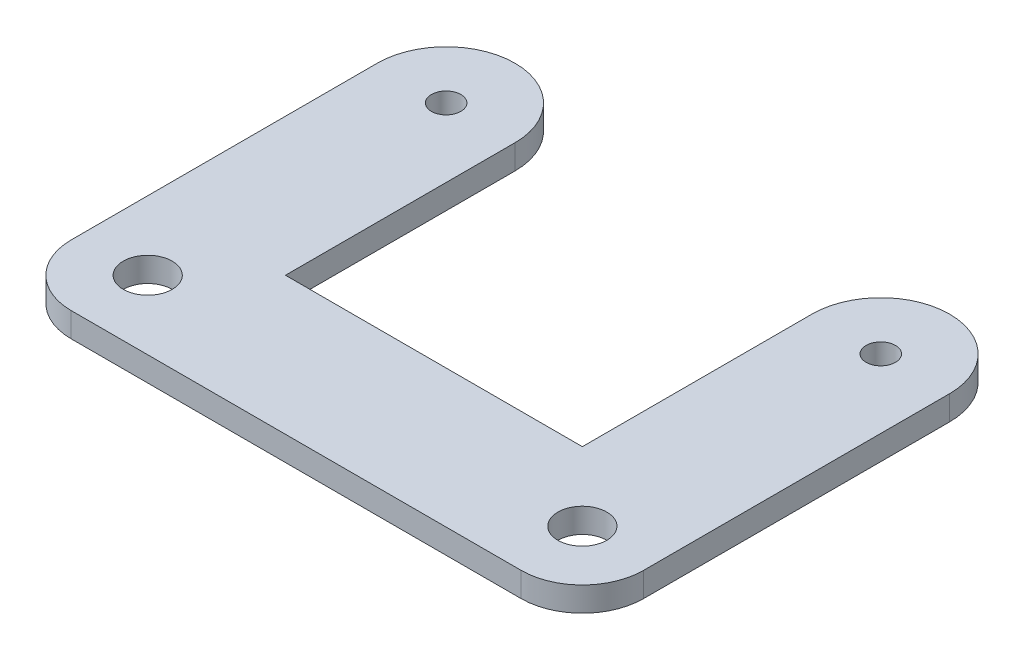
from build123d import *

# Parameters (mm, degrees)
SKETCH1_R           = 2.4
SKETCH1_R_2         = 4
BOSS_EXTRUDE1_DEPTH = 4
FILLET1_R           = 10


with BuildPart() as part:
    # Sketch1 → Boss-Extrude1 (new body)
    with BuildSketch(Plane(origin=(0, 0, 0), x_dir=(1, 0, 0), z_dir=(0, 1, 0))):
        with BuildLine():
            ThreePointArc((-24.25, 0), (-35.5, 11.25), (-46.75, 0))
            Line((-46.75, 0), (-46.75, -60))
            Line((-46.75, -60), (46.75, -60))
            Line((46.75, -60), (46.75, 0))
            ThreePointArc((46.75, 0), (35.5, 11.25), (24.25, 0))
            Line((24.25, 0), (24.25, -37.5))
            Line((24.25, -37.5), (-24.25, -37.5))
            Line((-24.25, -37.5), (-24.25, 0))
        make_face()
        with Locations((-35.5, 0)):
            Circle(SKETCH1_R, mode=Mode.SUBTRACT)
        with Locations((35.5, -48.75)):
            Circle(SKETCH1_R_2, mode=Mode.SUBTRACT)
        with Locations((-35.5, -48.75)):
            Circle(SKETCH1_R_2, mode=Mode.SUBTRACT)
        with Locations((35.5, 0)):
            Circle(SKETCH1_R, mode=Mode.SUBTRACT)
    extrude(amount=BOSS_EXTRUDE1_DEPTH)

    # Fillet1
    fillet1_edges = [part.edges().sort_by_distance(p)[0] for p in [
        (46.75, 2, 60),
        (-46.75, 2, 60),
    ]]
    fillet(fillet1_edges, radius=FILLET1_R)


solid = part.part
